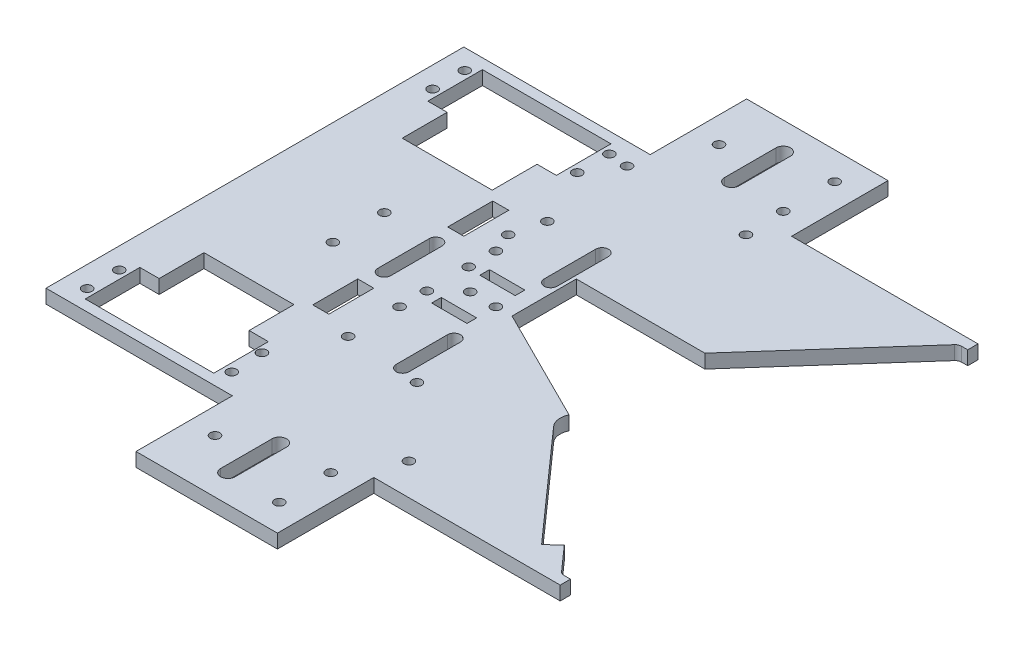
from build123d import *

# Parameters (mm, degrees)
BOSS_EXTRUDE1_DEPTH = 4.3
CUT_EXTRUDE1_DEPTH  = 4.5
FILLET1_R           = 2
CUT_EXTRUDE2_DEPTH  = 10
SKETCH8_R           = 1.5
CUT_EXTRUDE3_DEPTH  = 10
SKETCH9_R           = 1.5
CUT_EXTRUDE4_DEPTH  = 10
CUT_EXTRUDE5_DEPTH  = 10
SKETCH11_R          = 1.5
CUT_EXTRUDE6_DEPTH  = 10
SKETCH12_R          = 1.5
CUT_EXTRUDE7_DEPTH  = 10
SKETCH7_R           = 1.5
SKETCH7_W           = 11
SKETCH7_H           = 3
CUT_EXTRUDE8_DEPTH  = 9
SKETCH13_R          = 1.5
CUT_EXTRUDE9_DEPTH  = 10
SKETCH14_R          = 1.5
CUT_EXTRUDE10_DEPTH = 10
SKETCH15_W          = 5
SKETCH15_H          = 14
CUT_EXTRUDE11_DEPTH = 10


with BuildPart() as part:
    # Sketch2 → Boss-Extrude1 (new body)
    with BuildSketch(Plane(origin=(0, 0, 0), x_dir=(1, 0, 0), z_dir=(0, 1, 0))):
        Polygon((0, 0), (0, 65), (58, 65), (58, 95), (102, 95), (102, 65), (160, 65), (160, 0), align=None)
    extrude(amount=BOSS_EXTRUDE1_DEPTH)

    # Mirror1: part across plane


with BuildPart() as part_1:
    add(part.part)
    add(part.part.mirror(Plane(origin=(0, 4.3, 0), x_dir=(1, 0, 0), z_dir=(0, 0, -1))))

    # Sketch3 → Cut-Extrude1 (cut)
    with BuildSketch(Plane(origin=(0, 4.3, 0), x_dir=(1, 0, 0), z_dir=(0, 1, 0))):
        Polygon((160, -61.8), (160, 61.8), (157.156451185, 61.8), (120.012594795, 20), (80.012594795, 20), (80.012594795, 0), (120, -20), (157.155555556, -61.8), align=None)
    extrude(amount=-CUT_EXTRUDE1_DEPTH, mode=Mode.SUBTRACT)

    # Fillet1
    fillet1_edges = [part_1.edges().sort_by_distance(p)[0] for p in [
        (157.156451185, 2.15, -61.8),
        (157.155555556, 2.15, 61.8),
    ]]
    fillet(fillet1_edges, radius=FILLET1_R)

    # Sketch6 → Cut-Extrude2 (cut)
    with BuildSketch(Plane(origin=(0, 4.3, 0), x_dir=(1, 0, 0), z_dir=(0, 1, 0))):
        Polygon((9, -61.8), (49, -61.8), (49, -44.8), (43, -44.8), (43, -30.841820122), (15, -30.841820122), (15, -44.8), (9, -44.8), align=None)
        Polygon((9, 44.8), (15, 44.8), (15, 30.841820122), (43, 30.841820122), (43, 44.8), (49, 44.8), (49, 61.8), (9, 61.8), align=None)
    extrude(amount=-CUT_EXTRUDE2_DEPTH, mode=Mode.SUBTRACT)

    # Sketch8 → Cut-Extrude3 (cut)
    with BuildSketch(Plane(origin=(0, 4.3, 0), x_dir=(1, 0, 0), z_dir=(0, 1, 0))):
        with Locations((6.5, 58.8)):
            Circle(SKETCH8_R)
        with Locations((6.5, 48.8)):
            Circle(SKETCH8_R)
        with Locations((51.5, 48.8)):
            Circle(SKETCH8_R)
        with Locations((51.5, 58.8)):
            Circle(SKETCH8_R)
        with Locations((6.5, -48.7)):
            Circle(SKETCH8_R)
        with Locations((6.5, -58.7)):
            Circle(SKETCH8_R)
        with Locations((51.5, -58.7)):
            Circle(SKETCH8_R)
        with Locations((51, -48.8)):
            Circle(SKETCH8_R)
    extrude(amount=-CUT_EXTRUDE3_DEPTH, mode=Mode.SUBTRACT)

    # Sketch9 → Cut-Extrude4 (cut)
    with BuildSketch(Plane.XZ):
        with Locations((94, 70.4)):
            Circle(SKETCH9_R)
        with Locations((66, 78.4)):
            Circle(SKETCH9_R)
        with Locations((66, -78.4)):
            Circle(SKETCH9_R)
        with Locations((94, -86.4)):
            Circle(SKETCH9_R)
        with Locations((94, 86.4)):
            Circle(SKETCH9_R)
        with Locations((94, -70.4)):
            Circle(SKETCH9_R)
        with BuildLine():
            Line((75.75, 70.4), (75.75, 86.4))
            ThreePointArc((75.75, 86.4), (78, 88.65), (80.25, 86.4))
            Line((80.25, 86.4), (80.25, 70.4))
            ThreePointArc((80.25, 70.4), (78, 68.15), (75.75, 70.4))
        make_face()
        with BuildLine():
            Line((75.75, -86.4), (75.75, -70.4))
            ThreePointArc((75.75, -70.4), (78, -68.15), (80.25, -70.4))
            Line((80.25, -70.4), (80.25, -86.4))
            ThreePointArc((80.25, -86.4), (78, -88.65), (75.75, -86.4))
        make_face()
    extrude(amount=-CUT_EXTRUDE4_DEPTH, mode=Mode.SUBTRACT)

    # Sketch10 → Cut-Extrude5 (cut)
    with BuildSketch(Plane(origin=(0, 4.3, 0), x_dir=(1, 0, 0), z_dir=(0, 1, 0))):
        with BuildLine():
            Line((123.321819194, -23.737046593), (149.896372747, -53.633419341))
            Line((149.896372747, -53.633419341), (146.159326154, -56.955238535))
            Line((146.159326154, -56.955238535), (116.262953407, -23.321819194))
            ThreePointArc((116.262953407, -23.321819194), (120.29361011, -15.008628134), (123.321819194, -23.737046593))
        make_face()
    extrude(amount=-CUT_EXTRUDE5_DEPTH, mode=Mode.SUBTRACT)

    # Sketch11 → Cut-Extrude6 (cut)
    with BuildSketch(Plane.XZ):
        with BuildLine():
            ThreePointArc((79, 31.031280577), (77, 33.031280577), (75, 31.031280577))
            Line((75, 31.031280577), (75, 15.031280577))
            ThreePointArc((75, 15.031280577), (77, 13.031280577), (79, 15.031280577))
            Line((79, 15.031280577), (79, 31.031280577))
        make_face()
        with BuildLine():
            ThreePointArc((75, -31.031280577), (77, -33.031280577), (79, -31.031280577))
            Line((79, -31.031280577), (79, -15.031280577))
            ThreePointArc((79, -15.031280577), (77, -13.031280577), (75, -15.031280577))
            Line((75, -15.031280577), (75, -31.031280577))
        make_face()
        with Locations((60, 31)):
            Circle(SKETCH11_R)
        with Locations((60, 15)):
            Circle(SKETCH11_R)
        with Locations((60, -15)):
            Circle(SKETCH11_R)
        with Locations((60, -31)):
            Circle(SKETCH11_R)
    extrude(amount=-CUT_EXTRUDE6_DEPTH, mode=Mode.SUBTRACT)

    # Sketch12 → Cut-Extrude7 (cut)
    with BuildSketch(Plane(origin=(0, 0, 0), x_dir=(-1, 0, 0), z_dir=(0, -1, 0))):
        with BuildLine():
            ThreePointArc((-50.262723036, -8), (-48.262723036, -10), (-46.262723036, -8))
            Line((-46.262723036, -8), (-46.262723036, 8))
            ThreePointArc((-46.262723036, 8), (-48.262723036, 10), (-50.262723036, 8))
            Line((-50.262723036, 8), (-50.262723036, -8))
        make_face()
        with Locations((-32.262723036, -8)):
            Circle(SKETCH12_R)
        with Locations((-32.262723036, 8)):
            Circle(SKETCH12_R)
    extrude(amount=-CUT_EXTRUDE7_DEPTH, mode=Mode.SUBTRACT)

    # Sketch7 → Cut-Extrude8 (cut)
    with BuildSketch(Plane(origin=(0, 4.3, 0), x_dir=(1, 0, 0), z_dir=(0, 1, 0))):
        with Locations((60.012594795, -6.5)):
            Circle(SKETCH7_R)
        with Locations((60.012594795, 6.5)):
            Circle(SKETCH7_R)
        with Locations((69.5, -7.5)):
            Rectangle(SKETCH7_W, SKETCH7_H)
        with Locations((69.5, 7.5)):
            Rectangle(SKETCH7_W, SKETCH7_H)
    extrude(amount=-CUT_EXTRUDE8_DEPTH, mode=Mode.SUBTRACT)

    # Sketch13 → Cut-Extrude9 (cut)
    with BuildSketch(Plane(origin=(0, 4.3, 0), x_dir=(1, 0, 0), z_dir=(0, 1, 0))):
        with Locations((75, 0)):
            Circle(SKETCH13_R)
        with Locations((67, 0)):
            Circle(SKETCH13_R)
    extrude(amount=-CUT_EXTRUDE9_DEPTH, mode=Mode.SUBTRACT)

    # Sketch14 → Cut-Extrude10 (cut)
    with BuildSketch(Plane(origin=(0, 4.3, 0), x_dir=(1, 0, 0), z_dir=(0, 1, 0))):
        with Locations((57.5, 58.3)):
            Circle(SKETCH14_R)
        with Locations((94.5, 58.3)):
            Circle(SKETCH14_R)
        with Locations((57.5, 21.3)):
            Circle(SKETCH14_R)
        with Locations((83.127806945, -32.705958418)):
            Circle(SKETCH14_R)
        with Locations((103.05872211, -55.128237978)):
            Circle(SKETCH14_R)
    extrude(amount=-CUT_EXTRUDE10_DEPTH, mode=Mode.SUBTRACT)

    # Sketch15 → Cut-Extrude11 (cut)
    with BuildSketch(Plane(origin=(0, 4.3, 0), x_dir=(1, 0, 0), z_dir=(0, 1, 0))):
        with Locations((48.5, 21)):
            Rectangle(SKETCH15_W, SKETCH15_H)
        with Locations((48.5, -21)):
            Rectangle(SKETCH15_W, SKETCH15_H)
    extrude(amount=-CUT_EXTRUDE11_DEPTH, mode=Mode.SUBTRACT)


solid = part_1.part
